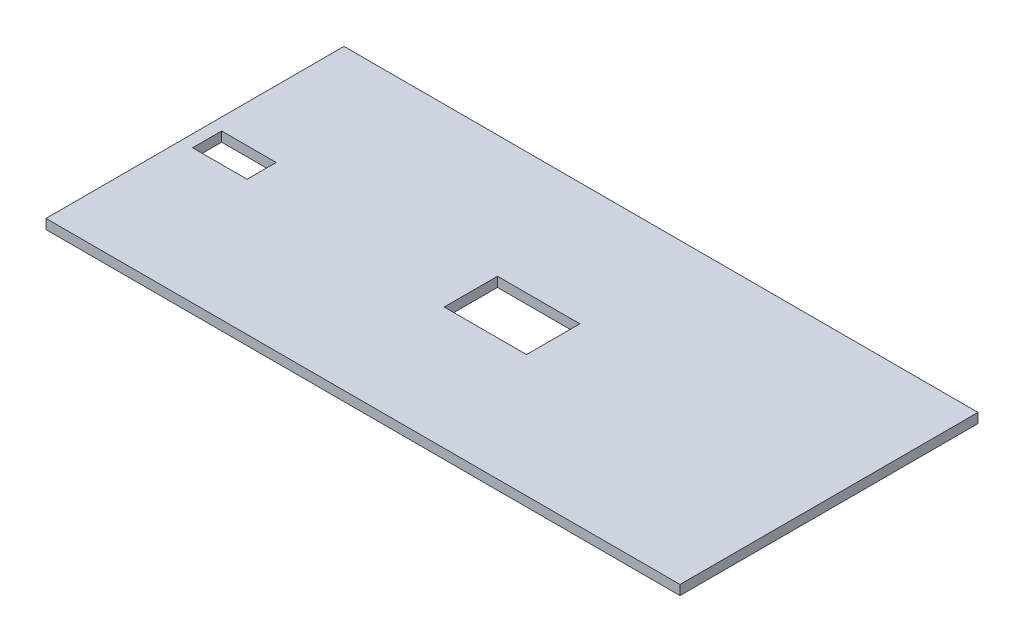
from build123d import *

# Parameters (mm, degrees)
SKETCH1_W           = 261.7
SKETCH1_H           = 123
BOSS_EXTRUDE7_DEPTH = 4
SKETCH2_W           = 22.5
SKETCH2_H           = 12
CUT_EXTRUDE1_DEPTH  = 4
SKETCH3_W           = 34
SKETCH3_H           = 22
CUT_EXTRUDE2_DEPTH  = 4


with BuildPart() as part:
    # Sketch1 → Boss-Extrude7 (new body)
    with BuildSketch(Plane(origin=(0, 0, 0), x_dir=(1, 0, 0), z_dir=(0, 1, 0))):
        with Locations((212.120150391, 127.752283774)):
            Rectangle(SKETCH1_W, SKETCH1_H)
    extrude(amount=BOSS_EXTRUDE7_DEPTH)

    # Sketch2 → Cut-Extrude1 (cut)
    with BuildSketch(Plane(origin=(0, 4, 0), x_dir=(1, 0, 0), z_dir=(0, 1, 0))):
        with Locations((97.520150391, 127.752283774)):
            Rectangle(SKETCH2_W, SKETCH2_H)
    extrude(amount=-CUT_EXTRUDE1_DEPTH, mode=Mode.SUBTRACT)

    # Sketch3 → Cut-Extrude2 (cut)
    with BuildSketch(Plane(origin=(0, 4, 0), x_dir=(1, 0, 0), z_dir=(0, 1, 0))):
        with Locations((212.120150391, 127.752283774)):
            Rectangle(SKETCH3_W, SKETCH3_H)
    extrude(amount=-CUT_EXTRUDE2_DEPTH, mode=Mode.SUBTRACT)


solid = part.part
